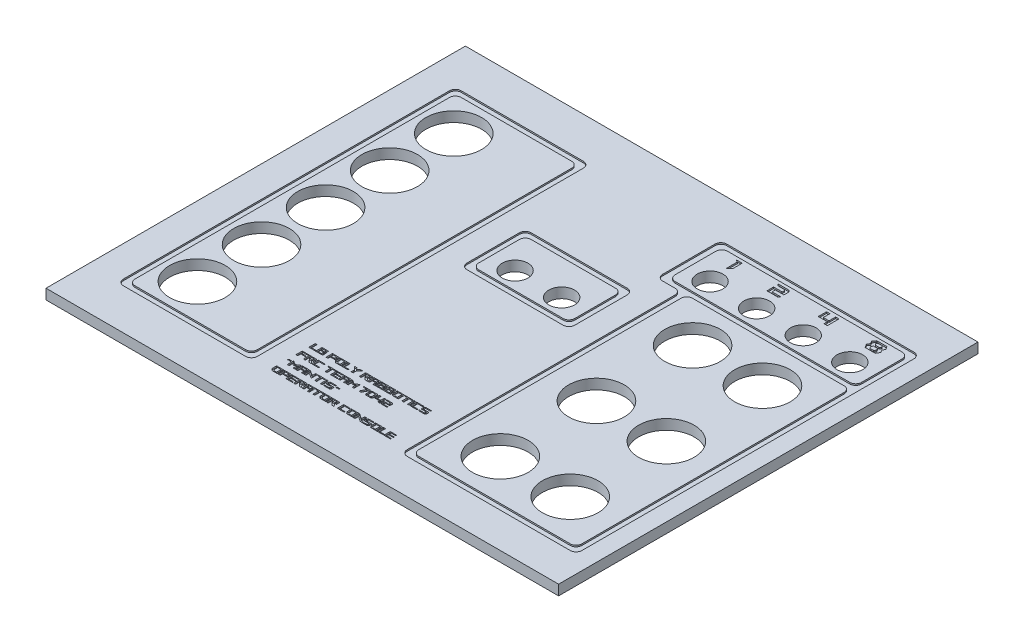
from build123d import *

# Parameters (mm, degrees)
SKETCH1_W           = 279.4
SKETCH1_H           = 228.6
BOSS_EXTRUDE1_DEPTH = 5.55625
SKETCH2_R           = 15.160625
CUT_EXTRUDE1_DEPTH  = 181.586411211
SKETCH3_R           = 7.0246875
SKETCH3_R_2         = 15.160625
CUT_EXTRUDE2_DEPTH  = 181.586411211
SKETCH4_W           = 73.025
SKETCH4_H           = 184.15
SKETCH4_W_2         = 66.675
SKETCH4_H_2         = 177.8
SKETCH4_W_3         = 88.9
SKETCH4_H_3         = 149.225
SKETCH4_W_4         = 101.6
SKETCH4_H_4         = 28.575
CUT_EXTRUDE3_DEPTH  = 0.79375
FILLET1_R           = 3.175
SKETCH5_W           = 1.743010591
SKETCH5_H           = 0.819065149
SKETCH5_H_2         = 1.141619432
SKETCH5_W_2         = 1.782964988
SKETCH5_H_3         = 1.234104295
SKETCH5_W_3         = 1.807936488
SKETCH5_H_4         = 0.965318114
SKETCH5_W_4         = 1.743010592
SKETCH5_W_5         = 1.049133865
SKETCH5_H_5         = 3.5
SKETCH5_W_6         = 1.807936487
SKETCH5_W_7         = 1.782964989
CUT_EXTRUDE4_DEPTH  = 0.79375
CUT_EXTRUDE5_DEPTH  = 0.79375
CUT_EXTRUDE6_DEPTH  = 0.79375
SKETCH8_R           = 7.0246875
CUT_EXTRUDE7_DEPTH  = 181.586411211


with BuildPart() as part:
    # Sketch1 → Boss-Extrude1 (new body)
    with BuildSketch(Plane(origin=(0, 0, 0), x_dir=(1, 0, 0), z_dir=(0, 1, 0))):
        Rectangle(SKETCH1_W, SKETCH1_H)
    extrude(amount=BOSS_EXTRUDE1_DEPTH)

    # Sketch2 → Cut-Extrude1 (cut, through all)
    with BuildSketch(Plane(origin=(0, 5.55625, 0), x_dir=(1, 0, 0), z_dir=(0, 1, 0))):
        with Locations((-101.6, 69.85)):
            Circle(SKETCH2_R)
        with Locations((-101.6, 34.925)):
            Circle(SKETCH2_R)
        with Locations((-101.6, 0)):
            Circle(SKETCH2_R)
        with Locations((-101.6, -34.925)):
            Circle(SKETCH2_R)
        with Locations((-101.6, -69.85)):
            Circle(SKETCH2_R)
    extrude(amount=-CUT_EXTRUDE1_DEPTH, mode=Mode.SUBTRACT)

    # Sketch3 → Cut-Extrude2 (cut, through all)
    with BuildSketch(Plane(origin=(0, 5.55625, 0), x_dir=(1, 0, 0), z_dir=(0, 1, 0))):
        with Locations((38.1, 69.85)):
            Circle(SKETCH3_R)
        with Locations((63.5, 69.85)):
            Circle(SKETCH3_R)
        with Locations((88.9, 69.85)):
            Circle(SKETCH3_R)
        with Locations((114.3, 69.85)):
            Circle(SKETCH3_R)
        with Locations((63.5, 34.925)):
            Circle(SKETCH3_R_2)
        with Locations((101.6, 34.925)):
            Circle(SKETCH3_R_2)
        with Locations((101.6, -17.4625)):
            Circle(SKETCH3_R_2)
        with Locations((63.5, -17.4625)):
            Circle(SKETCH3_R_2)
        with Locations((101.6, -69.85)):
            Circle(SKETCH3_R_2)
        with Locations((63.5, -69.85)):
            Circle(SKETCH3_R_2)
    extrude(amount=-CUT_EXTRUDE2_DEPTH, mode=Mode.SUBTRACT)

    # Sketch4 → Cut-Extrude3 (cut)
    # profile 1 of 2: a face of its own
    with BuildSketch(Plane(origin=(0, 5.55625, 0), x_dir=(1, 0, 0), z_dir=(0, 1, 0))):
        with Locations((-86.439375, 0)):
            Rectangle(SKETCH4_W, SKETCH4_H)
        with Locations((-86.439375, 0)):
            Rectangle(SKETCH4_W_2, SKETCH4_H_2, mode=Mode.SUBTRACT)
    # profile 2 of 2: a face of its own
    with BuildSketch(Plane(origin=(0, 5.55625, 0), x_dir=(1, 0, 0), z_dir=(0, 1, 0))):
        Polygon((130.175, 60.325), (130.175, -95.25), (34.925, -95.25), (34.925, 57.15), (21.779463134, 57.15), (21.779463134, 92.075), (130.175, 92.075), align=None)
        with Locations((82.55, -17.4625)):
            Rectangle(SKETCH4_W_3, SKETCH4_H_3, mode=Mode.SUBTRACT)
        with Locations((76.2, 74.6125)):
            Rectangle(SKETCH4_W_4, SKETCH4_H_4, mode=Mode.SUBTRACT)
    extrude(amount=-CUT_EXTRUDE3_DEPTH, mode=Mode.SUBTRACT)

    # Fillet1
    fillet1_edges = [part.edges().sort_by_distance(p)[0] for p in [
        (130.175, 5.159375, 95.25),
        (127, 5.159375, 92.075),
        (34.925, 5.159375, 95.25),
        (38.1, 5.159375, 92.075),
        (-119.776875, 5.159375, 88.9),
        (-122.951875, 5.159375, 92.075),
        (-49.926875, 5.159375, 92.075),
        (-53.101875, 5.159375, 88.9),
        (38.1, 5.159375, -57.15),
        (127, 5.159375, -57.15),
        (34.925, 5.159375, -57.15),
        (127, 5.159375, -60.325),
        (130.175, 5.159375, -92.075),
        (127, 5.159375, -88.9),
        (21.779463134, 5.159375, -57.15),
        (25.4, 5.159375, -60.325),
        (21.779463134, 5.159375, -92.075),
        (25.4, 5.159375, -88.9),
        (-49.926875, 5.159375, -92.075),
        (-53.101875, 5.159375, -88.9),
        (-122.951875, 5.159375, -92.075),
        (-119.776875, 5.159375, -88.9),
    ]]
    fillet(fillet1_edges, radius=FILLET1_R)

    # Sketch5 → Cut-Extrude4 (cut)
    # profile 1 of 51: a face of its own
    with BuildSketch(Plane(origin=(0, 5.55625, 0), x_dir=(1, 0, 0), z_dir=(0, 1, 0))):
        Polygon((-36.802163997, -70.03379494), (-37.252626826, -70.54878923), (-40.209679135, -70.54878923), (-40.209679135, -67.04878923), (-39.163953361, -67.04878923), (-39.163953361, -70.03379494), align=None)
    # profile 2 of 51: a face of its own
    with BuildSketch(Plane(origin=(0, 5.55625, 0), x_dir=(1, 0, 0), z_dir=(0, 1, 0))):
        Polygon((-32.683092397, -70.55453218), (-36.513720258, -70.55453218), (-36.513720258, -67.04247403), (-32.987744678, -67.04247403), (-32.987744678, -68.375952047), (-32.683092397, -68.375952047), align=None)
        with Locations((-34.598406328, -67.966419473)):
            Rectangle(SKETCH5_W, SKETCH5_H, mode=Mode.SUBTRACT)
        with Locations((-34.598406328, -69.469309596)):
            Rectangle(SKETCH5_W, SKETCH5_H_2, mode=Mode.SUBTRACT)
    # profile 3 of 51: a face of its own
    with BuildSketch(Plane(origin=(0, 5.55625, 0), x_dir=(1, 0, 0), z_dir=(0, 1, 0))):
        Polygon((-29.773910712, -69.305977015), (-29.773910712, -70.544563338), (-30.822713646, -70.544563338), (-30.822713646, -67.043046984), (-26.952131388, -67.043046984), (-26.952131388, -69.305977015), align=None)
        with Locations((-28.892416817, -68.174511999)):
            Rectangle(SKETCH5_W_2, SKETCH5_H_3, mode=Mode.SUBTRACT)
    # profile 4 of 51: a face of its own
    with BuildSketch(Plane(origin=(0, 5.55625, 0), x_dir=(1, 0, 0), z_dir=(0, 1, 0))):
        Polygon((-22.605629343, -70.553124491), (-22.605629343, -67.044453969), (-26.568057888, -67.044453969), (-26.568057888, -69.594269754), (-25.714708614, -70.553124491), align=None)
        Polygon((-23.654763208, -67.547344949), (-23.654763208, -70.050234216), (-24.928968668, -70.050234216), (-25.518924023, -69.366287524), (-25.518924023, -67.547344949), align=None, mode=Mode.SUBTRACT)
    # profile 5 of 51: a face of its own
    with BuildSketch(Plane(origin=(0, 5.55625, 0), x_dir=(1, 0, 0), z_dir=(0, 1, 0))):
        Polygon((-18.813721064, -70.03379494), (-19.264183893, -70.54878923), (-22.221236202, -70.54878923), (-22.221236202, -67.04878923), (-21.175510428, -67.04878923), (-21.175510428, -70.03379494), align=None)
    # profile 6 of 51: a face of its own
    with BuildSketch(Plane(origin=(0, 5.55625, 0), x_dir=(1, 0, 0), z_dir=(0, 1, 0))):
        Polygon((-17.088287191, -70.553125196), (-16.039154031, -70.553125196), (-16.039154031, -68.905006299), (-14.401023733, -67.057115414), (-15.609644258, -67.057115414), (-16.563737545, -68.135884147), (-17.517796964, -67.057115414), (-18.726417488, -67.057115414), (-17.088287191, -68.905006299), align=None)
    # profile 7 of 51: a face of its own
    with BuildSketch(Plane(origin=(0, 5.55625, 0), x_dir=(1, 0, 0), z_dir=(0, 1, 0))):
        Polygon((-8.386582238, -70.573506709), (-9.620174261, -70.573506709), (-11.503025243, -68.425957843), (-9.735043154, -68.425957843), (-9.735043154, -67.599367375), (-11.635973953, -67.599367375), (-11.635973953, -70.573506709), (-12.694765486, -70.573506709), (-12.694765486, -67.084954507), (-8.706217418, -67.084954507), (-8.706217418, -68.940370711), (-9.814951949, -68.940370711), align=None)
    # profile 8 of 51: a face of its own
    with BuildSketch(Plane(origin=(0, 5.55625, 0), x_dir=(1, 0, 0), z_dir=(0, 1, 0))):
        Polygon((-4.199478651, -67.084954507), (-4.199478651, -70.572393964), (-5.248281586, -70.572393964), (-5.248281586, -69.084092657), (-7.096172471, -69.084092657), (-7.096172471, -70.572393964), (-8.164952604, -70.572393964), (-8.164952604, -67.084954507), align=None)
        with Locations((-6.177221328, -68.082026432)):
            Rectangle(SKETCH5_W_3, SKETCH5_H_4, mode=Mode.SUBTRACT)
    # profile 9 of 51: a face of its own
    with BuildSketch(Plane(origin=(0, 5.55625, 0), x_dir=(1, 0, 0), z_dir=(0, 1, 0))):
        Polygon((0.010555813, -70.55453218), (-3.820072048, -70.55453218), (-3.820072048, -67.04247403), (-0.294096468, -67.04247403), (-0.294096468, -68.375952047), (0.010555813, -68.375952047), align=None)
        with Locations((-1.904758118, -67.966419473)):
            Rectangle(SKETCH5_W, SKETCH5_H, mode=Mode.SUBTRACT)
        with Locations((-1.904758118, -69.469309596)):
            Rectangle(SKETCH5_W, SKETCH5_H_2, mode=Mode.SUBTRACT)
    # profile 10 of 51: a face of its own
    with BuildSketch(Plane(origin=(0, 5.55625, 0), x_dir=(1, 0, 0), z_dir=(0, 1, 0))):
        Polygon((4.218649146, -70.55453218), (0.388021286, -70.55453218), (0.388021286, -67.04247403), (3.913996865, -67.04247403), (3.913996865, -68.375952047), (4.218649146, -68.375952047), align=None)
        with Locations((2.303335216, -67.966419473)):
            Rectangle(SKETCH5_W_4, SKETCH5_H, mode=Mode.SUBTRACT)
        with Locations((2.303335216, -69.469309596)):
            Rectangle(SKETCH5_W_4, SKETCH5_H_2, mode=Mode.SUBTRACT)
    # profile 11 of 51: a face of its own
    with BuildSketch(Plane(origin=(0, 5.55625, 0), x_dir=(1, 0, 0), z_dir=(0, 1, 0))):
        Polygon((8.562006998, -70.553124491), (8.562006998, -67.044453969), (4.599578454, -67.044453969), (4.599578454, -69.594269754), (5.452927727, -70.553124491), align=None)
        Polygon((7.512873133, -67.547344949), (7.512873133, -70.050234216), (6.238667674, -70.050234216), (5.648712319, -69.366287524), (5.648712319, -67.547344949), align=None, mode=Mode.SUBTRACT)
    # profile 12 of 51: a face of its own
    with BuildSketch(Plane(origin=(0, 5.55625, 0), x_dir=(1, 0, 0), z_dir=(0, 1, 0))):
        Polygon((12.839335381, -67.563822328), (11.5483703, -67.563822328), (11.5483703, -70.54878923), (10.506626277, -70.54878923), (10.506626277, -67.563822328), (9.200707932, -67.563822328), (8.757094448, -67.04878923), (13.28310551, -67.04878923), align=None)
    # profile 13 of 51: a face of its own
    with BuildSketch(Plane(origin=(0, 5.55625, 0), x_dir=(1, 0, 0), z_dir=(0, 1, 0))):
        with Locations((14.09524546, -68.79878923)):
            Rectangle(SKETCH5_W_5, SKETCH5_H_5)
    # profile 14 of 51: a face of its own
    with BuildSketch(Plane(origin=(0, 5.55625, 0), x_dir=(1, 0, 0), z_dir=(0, 1, 0))):
        Polygon((19.063454202, -70.03379494), (18.615261317, -70.54878923), (15.138597919, -70.54878923), (15.138597919, -67.04878923), (19.058560804, -67.04878923), (18.615261317, -67.563822328), (16.204509047, -67.563822328), (16.204509047, -70.03379494), align=None)
    # profile 15 of 51: a face of its own
    with BuildSketch(Plane(origin=(0, 5.55625, 0), x_dir=(1, 0, 0), z_dir=(0, 1, 0))):
        Polygon((23.383155104, -70.029679123), (22.930792776, -70.558867441), (19.794082567, -70.558867441), (19.346691253, -70.044454573), (22.14537247, -70.044454573), (22.32930001, -69.832673123), (22.32930001, -69.079135754), (19.480908647, -69.079135754), (19.480908647, -67.638932277), (19.953155034, -67.084954507), (23.50276075, -67.084954507), (23.06501017, -67.599367375), (20.743546354, -67.599367375), (20.519850698, -67.85180601), (20.519850698, -68.564685489), (23.383155104, -68.564685489), align=None)
    # profile 16 of 51: a face of its own
    with BuildSketch(Plane(origin=(0, 5.55625, 0), x_dir=(1, 0, 0), z_dir=(0, 1, 0))):
        Polygon((-39.190410166, -75.905689832), (-39.190410166, -77.568791629), (-40.209679135, -77.568791629), (-40.209679135, -74.096516413), (-36.432222432, -74.096516413), (-36.872072903, -74.610929281), (-39.190410166, -74.610929281), (-39.190410166, -75.391276965), (-36.577284329, -75.391276965), (-37.026961815, -75.905689832), align=None)
    # profile 17 of 51: a face of its own
    with BuildSketch(Plane(origin=(0, 5.55625, 0), x_dir=(1, 0, 0), z_dir=(0, 1, 0))):
        Polygon((-31.83167367, -77.585068614), (-33.065265693, -77.585068614), (-34.948116675, -75.437519748), (-33.180134585, -75.437519748), (-33.180134585, -74.610929281), (-35.081065384, -74.610929281), (-35.081065384, -77.585068614), (-36.139856918, -77.585068614), (-36.139856918, -74.096516413), (-32.15130885, -74.096516413), (-32.15130885, -75.951932616), (-33.26004338, -75.951932616), align=None)
    # profile 18 of 51: a face of its own
    with BuildSketch(Plane(origin=(0, 5.55625, 0), x_dir=(1, 0, 0), z_dir=(0, 1, 0))):
        Polygon((-27.68800031, -77.045356846), (-28.136193195, -77.560351135), (-31.612856593, -77.560351135), (-31.612856593, -74.060351135), (-27.692893708, -74.060351135), (-28.136193195, -74.575384233), (-30.546945465, -74.575384233), (-30.546945465, -77.045356846), align=None)
    # profile 19 of 51: a face of its own
    with BuildSketch(Plane(origin=(0, 5.55625, 0), x_dir=(1, 0, 0), z_dir=(0, 1, 0))):
        Polygon((-21.981480887, -74.575384233), (-23.272445969, -74.575384233), (-23.272445969, -77.560351135), (-24.314189992, -77.560351135), (-24.314189992, -74.575384233), (-25.620108337, -74.575384233), (-26.06372182, -74.060351135), (-21.537710758, -74.060351135), align=None)
    # profile 20 of 51: a face of its own
    with BuildSketch(Plane(origin=(0, 5.55625, 0), x_dir=(1, 0, 0), z_dir=(0, 1, 0))):
        Polygon((-17.881404278, -77.056016479), (-17.431980811, -77.570429347), (-21.346958569, -77.570429347), (-21.346958569, -74.096516413), (-17.422102287, -74.096516413), (-17.866423496, -74.610929281), (-20.298303813, -74.610929281), (-20.298303813, -75.576247395), (-17.656692545, -75.576247395), (-17.656692545, -76.09069766), (-20.298303813, -76.09069766), (-20.298303813, -77.056016479), align=None)
    # profile 21 of 51: a face of its own
    with BuildSketch(Plane(origin=(0, 5.55625, 0), x_dir=(1, 0, 0), z_dir=(0, 1, 0))):
        Polygon((-13.170578726, -74.096516413), (-13.170578726, -77.583955869), (-14.21938166, -77.583955869), (-14.21938166, -76.095654562), (-16.067272545, -76.095654562), (-16.067272545, -77.583955869), (-17.136052678, -77.583955869), (-17.136052678, -74.096516413), align=None)
        with Locations((-15.148321403, -75.093588338)):
            Rectangle(SKETCH5_W_6, SKETCH5_H_4, mode=Mode.SUBTRACT)
    # profile 22 of 51: a face of its own
    with BuildSketch(Plane(origin=(0, 5.55625, 0), x_dir=(1, 0, 0), z_dir=(0, 1, 0))):
        Polygon((-12.79204355, -77.560351135), (-12.79204355, -74.060351135), (-10.64467038, -75.46037442), (-8.497245702, -74.060351135), (-8.497245702, -77.560351135), (-9.528634209, -77.560351135), (-9.528634209, -75.555373367), (-10.64467038, -76.265365494), (-11.750741943, -75.555373367), (-11.750741943, -77.560351135), align=None)
    # profile 23 of 51: a face of its own
    with BuildSketch(Plane(origin=(0, 5.55625, 0), x_dir=(1, 0, 0), z_dir=(0, 1, 0))):
        Polygon((-5.907196803, -77.564687102), (-4.701469275, -77.564687102), (-2.855625362, -74.056015874), (-6.780480939, -74.056015874), (-6.338877029, -74.558906855), (-4.438491666, -74.558906855), align=None)
    # profile 24 of 51: a face of its own
    with BuildSketch(Plane(origin=(0, 5.55625, 0), x_dir=(1, 0, 0), z_dir=(0, 1, 0))):
        Polygon((1.259981699, -74.609532881), (0.796130647, -74.056015874), (-2.196113199, -74.056015874), (-2.664873878, -74.609532881), (-2.664873878, -77.01133803), (-2.196113199, -77.564686396), (0.796130647, -77.564686396), (1.259981699, -77.01133803), align=None)
        Polygon((0.248420801, -74.851731719), (0.248420801, -76.759047573), (-0.004468012, -77.061796121), (-1.395364246, -77.061796121), (-1.653312275, -76.759047573), (-1.653312275, -74.851731719), (-1.395364246, -74.558906855), (-0.004468012, -74.558906855), align=None, mode=Mode.SUBTRACT)
    # profile 25 of 51: a face of its own
    with BuildSketch(Plane(origin=(0, 5.55625, 0), x_dir=(1, 0, 0), z_dir=(0, 1, 0))):
        Polygon((4.410271351, -77.564687102), (5.421832955, -77.564687102), (5.421832955, -74.066712199), (4.410271351, -74.066712199), (4.410271351, -76.044454876), (2.693509411, -76.044454876), (2.693509411, -74.066712199), (1.681947807, -74.066712199), (1.681947807, -76.547345856), (4.410271351, -76.547345856), align=None)
    # profile 26 of 51: a face of its own
    with BuildSketch(Plane(origin=(0, 5.55625, 0), x_dir=(1, 0, 0), z_dir=(0, 1, 0))):
        Polygon((9.180457662, -77.570429347), (5.871108244, -77.570429347), (5.871108244, -75.576247395), (8.451701983, -75.576247395), (8.451701983, -74.863367916), (8.227085507, -74.610929281), (6.190562788, -74.610929281), (5.75131279, -74.096516413), (9.02073039, -74.096516413), (9.494920729, -74.650494182), (9.494920729, -76.09069766), (6.929301421, -76.09069766), (6.929301421, -77.056016479), (9.629925583, -77.056016479), align=None)
    # profile 27 of 51: a face of its own
    with BuildSketch(Plane(origin=(0, 5.55625, 0), x_dir=(1, 0, 0), z_dir=(0, 1, 0))):
        Polygon((-40.259648945, -82.213532474), (-39.600401386, -82.213532474), (-39.245806108, -81.626826447), (-39.895065068, -81.626826447), align=None)
    # profile 28 of 51: a face of its own
    with BuildSketch(Plane(origin=(0, 5.55625, 0), x_dir=(1, 0, 0), z_dir=(0, 1, 0))):
        Polygon((-39.245806108, -82.213532474), (-38.58655855, -82.213532474), (-38.231963272, -81.626826447), (-38.881222231, -81.626826447), align=None)
    # profile 29 of 51: a face of its own
    with BuildSketch(Plane(origin=(0, 5.55625, 0), x_dir=(1, 0, 0), z_dir=(0, 1, 0))):
        Polygon((-37.901875202, -84.571913041), (-37.901875202, -81.071913041), (-35.754502032, -82.471936326), (-33.607077354, -81.071913041), (-33.607077354, -84.571913041), (-34.638465861, -84.571913041), (-34.638465861, -82.566935272), (-35.754502032, -83.2769274), (-36.860573595, -82.566935272), (-36.860573595, -84.571913041), align=None)
    # profile 30 of 51: a face of its own
    with BuildSketch(Plane(origin=(0, 5.55625, 0), x_dir=(1, 0, 0), z_dir=(0, 1, 0))):
        Polygon((-29.216824735, -81.108078319), (-29.216824735, -84.595517775), (-30.26562767, -84.595517775), (-30.26562767, -83.107216468), (-32.113518555, -83.107216468), (-32.113518555, -84.595517775), (-33.182298688, -84.595517775), (-33.182298688, -81.108078319), align=None)
        with Locations((-31.194567412, -82.105150243)):
            Rectangle(SKETCH5_W_3, SKETCH5_H_4, mode=Mode.SUBTRACT)
    # profile 31 of 51: a face of its own
    with BuildSketch(Plane(origin=(0, 5.55625, 0), x_dir=(1, 0, 0), z_dir=(0, 1, 0))):
        Polygon((-24.913433982, -84.571913041), (-27.755464281, -82.666934164), (-27.755464281, -84.571913041), (-28.792046775, -84.571913041), (-28.792046775, -81.071913041), (-25.93524526, -82.961930893), (-25.93524526, -81.071913041), (-24.913433982, -81.071913041), align=None)
    # profile 32 of 51: a face of its own
    with BuildSketch(Plane(origin=(0, 5.55625, 0), x_dir=(1, 0, 0), z_dir=(0, 1, 0))):
        Polygon((-20.640440154, -81.586946139), (-21.931405236, -81.586946139), (-21.931405236, -84.571913041), (-22.973149259, -84.571913041), (-22.973149259, -81.586946139), (-24.279067604, -81.586946139), (-24.722681088, -81.071913041), (-20.196670026, -81.071913041), align=None)
    # profile 33 of 51: a face of its own
    with BuildSketch(Plane(origin=(0, 5.55625, 0), x_dir=(1, 0, 0), z_dir=(0, 1, 0))):
        with Locations((-19.384530076, -82.821913041)):
            Rectangle(SKETCH5_W_5, SKETCH5_H_5)
    # profile 34 of 51: a face of its own
    with BuildSketch(Plane(origin=(0, 5.55625, 0), x_dir=(1, 0, 0), z_dir=(0, 1, 0))):
        Polygon((-14.350956549, -84.052802935), (-14.803318877, -84.581991252), (-17.940029087, -84.581991252), (-18.3874204, -84.067578385), (-15.588739183, -84.067578385), (-15.404811643, -83.855796934), (-15.404811643, -83.102259565), (-18.253203006, -83.102259565), (-18.253203006, -81.662056088), (-17.78095662, -81.108078319), (-14.231350904, -81.108078319), (-14.669101483, -81.622491186), (-16.990565299, -81.622491186), (-17.214260956, -81.874929821), (-17.214260956, -82.5878093), (-14.350956549, -82.5878093), align=None)
    # profile 35 of 51: a face of its own
    with BuildSketch(Plane(origin=(0, 5.55625, 0), x_dir=(1, 0, 0), z_dir=(0, 1, 0))):
        Polygon((-13.947504912, -82.213532474), (-13.288257353, -82.213532474), (-12.933662075, -81.626826447), (-13.582921035, -81.626826447), align=None)
    # profile 36 of 51: a face of its own
    with BuildSketch(Plane(origin=(0, 5.55625, 0), x_dir=(1, 0, 0), z_dir=(0, 1, 0))):
        Polygon((-12.933662075, -82.213532474), (-12.274414517, -82.213532474), (-11.919819239, -81.626826447), (-12.569078198, -81.626826447), align=None)
    # profile 37 of 51: a face of its own
    with BuildSketch(Plane(origin=(0, 5.55625, 0), x_dir=(1, 0, 0), z_dir=(0, 1, 0))):
        Polygon((-36.247250591, -91.587810207), (-36.247250591, -88.079139685), (-40.209679135, -88.079139685), (-40.209679135, -90.628955471), (-39.356329862, -91.587810207), align=None)
        Polygon((-37.296384456, -88.582030666), (-37.296384456, -91.084919933), (-38.570589915, -91.084919933), (-39.16054527, -90.40097324), (-39.16054527, -88.582030666), align=None, mode=Mode.SUBTRACT)
    # profile 38 of 51: a face of its own
    with BuildSketch(Plane(origin=(0, 5.55625, 0), x_dir=(1, 0, 0), z_dir=(0, 1, 0))):
        Polygon((-34.814374156, -90.340662732), (-34.814374156, -91.579249055), (-35.86317709, -91.579249055), (-35.86317709, -88.077732701), (-31.992594832, -88.077732701), (-31.992594832, -90.340662732), align=None)
        with Locations((-33.93288026, -89.209197717)):
            Rectangle(SKETCH5_W_7, SKETCH5_H_3, mode=Mode.SUBTRACT)
    # profile 39 of 51: a face of its own
    with BuildSketch(Plane(origin=(0, 5.55625, 0), x_dir=(1, 0, 0), z_dir=(0, 1, 0))):
        Polygon((-28.147302302, -91.07914029), (-27.697878834, -91.593553158), (-31.612856593, -91.593553158), (-31.612856593, -88.119640224), (-27.68800031, -88.119640224), (-28.132321519, -88.634053092), (-30.564201836, -88.634053092), (-30.564201836, -89.599371206), (-27.922590568, -89.599371206), (-27.922590568, -90.113821471), (-30.564201836, -90.113821471), (-30.564201836, -91.07914029), align=None)
    # profile 40 of 51: a face of its own
    with BuildSketch(Plane(origin=(0, 5.55625, 0), x_dir=(1, 0, 0), z_dir=(0, 1, 0))):
        Polygon((-23.091787515, -91.608192426), (-24.325379538, -91.608192426), (-26.20823052, -89.46064356), (-24.44024843, -89.46064356), (-24.44024843, -88.634053092), (-26.341179229, -88.634053092), (-26.341179229, -91.608192426), (-27.399970763, -91.608192426), (-27.399970763, -88.119640224), (-23.411422695, -88.119640224), (-23.411422695, -89.975056428), (-24.520157225, -89.975056428), align=None)
    # profile 41 of 51: a face of its own
    with BuildSketch(Plane(origin=(0, 5.55625, 0), x_dir=(1, 0, 0), z_dir=(0, 1, 0))):
        Polygon((-18.904683928, -88.119640224), (-18.904683928, -91.60707968), (-19.953486863, -91.60707968), (-19.953486863, -90.118778373), (-21.801377747, -90.118778373), (-21.801377747, -91.60707968), (-22.870157881, -91.60707968), (-22.870157881, -88.119640224), align=None)
        with Locations((-20.882426605, -89.116712149)):
            Rectangle(SKETCH5_W_6, SKETCH5_H_4, mode=Mode.SUBTRACT)
    # profile 42 of 51: a face of its own
    with BuildSketch(Plane(origin=(0, 5.55625, 0), x_dir=(1, 0, 0), z_dir=(0, 1, 0))):
        Polygon((-14.628878249, -88.598508044), (-15.91984333, -88.598508044), (-15.91984333, -91.583474946), (-16.961587353, -91.583474946), (-16.961587353, -88.598508044), (-18.267505698, -88.598508044), (-18.711119182, -88.083474946), (-14.18510812, -88.083474946), align=None)
    # profile 43 of 51: a face of its own
    with BuildSketch(Plane(origin=(0, 5.55625, 0), x_dir=(1, 0, 0), z_dir=(0, 1, 0))):
        Polygon((-10.027592125, -91.587810207), (-10.027592125, -88.079139685), (-13.99002067, -88.079139685), (-13.99002067, -90.628955471), (-13.136671397, -91.587810207), align=None)
        Polygon((-11.076725991, -88.582030666), (-11.076725991, -91.084919933), (-12.35093145, -91.084919933), (-12.940886805, -90.40097324), (-12.940886805, -88.582030666), align=None, mode=Mode.SUBTRACT)
    # profile 44 of 51: a face of its own
    with BuildSketch(Plane(origin=(0, 5.55625, 0), x_dir=(1, 0, 0), z_dir=(0, 1, 0))):
        Polygon((-5.334558501, -91.608192426), (-6.568150524, -91.608192426), (-8.451001507, -89.46064356), (-6.683019417, -89.46064356), (-6.683019417, -88.634053092), (-8.583950216, -88.634053092), (-8.583950216, -91.608192426), (-9.64274175, -91.608192426), (-9.64274175, -88.119640224), (-5.654193681, -88.119640224), (-5.654193681, -89.975056428), (-6.762928212, -89.975056428), align=None)
    # profile 45 of 51: a face of its own
    with BuildSketch(Plane(origin=(0, 5.55625, 0), x_dir=(1, 0, 0), z_dir=(0, 1, 0))):
        Polygon((0.288883943, -91.068480657), (-0.159308942, -91.583474946), (-3.63597234, -91.583474946), (-3.63597234, -88.083474946), (0.283990545, -88.083474946), (-0.159308942, -88.598508044), (-2.570061212, -88.598508044), (-2.570061212, -91.068480657), align=None)
    # profile 46 of 51: a face of its own
    with BuildSketch(Plane(origin=(0, 5.55625, 0), x_dir=(1, 0, 0), z_dir=(0, 1, 0))):
        Polygon((4.585127584, -91.587810207), (4.585127584, -88.079139685), (0.622699039, -88.079139685), (0.622699039, -90.628955471), (1.476048312, -91.587810207), align=None)
        Polygon((3.535993718, -88.582030666), (3.535993718, -91.084919933), (2.261788259, -91.084919933), (1.671832904, -90.40097324), (1.671832904, -88.582030666), align=None, mode=Mode.SUBTRACT)
    # profile 47 of 51: a face of its own
    with BuildSketch(Plane(origin=(0, 5.55625, 0), x_dir=(1, 0, 0), z_dir=(0, 1, 0))):
        Polygon((8.890041041, -91.583474946), (6.048010742, -89.678496069), (6.048010742, -91.583474946), (5.011428248, -91.583474946), (5.011428248, -88.083474946), (7.868229763, -89.973492798), (7.868229763, -88.083474946), (8.890041041, -88.083474946), align=None)
    # profile 48 of 51: a face of its own
    with BuildSketch(Plane(origin=(0, 5.55625, 0), x_dir=(1, 0, 0), z_dir=(0, 1, 0))):
        Polygon((13.255985433, -91.06436484), (12.803623104, -91.593553158), (9.666912895, -91.593553158), (9.219521581, -91.07914029), (12.018202798, -91.07914029), (12.202130338, -90.867358839), (12.202130338, -90.113821471), (9.353738975, -90.113821471), (9.353738975, -88.673617993), (9.825985362, -88.119640224), (13.375591078, -88.119640224), (12.937840498, -88.634053092), (10.616376683, -88.634053092), (10.392681026, -88.886491727), (10.392681026, -89.599371206), (13.255985433, -89.599371206), align=None)
    # profile 49 of 51: a face of its own
    with BuildSketch(Plane(origin=(0, 5.55625, 0), x_dir=(1, 0, 0), z_dir=(0, 1, 0))):
        Polygon((17.671835424, -91.587810207), (17.671835424, -88.079139685), (13.70940688, -88.079139685), (13.70940688, -90.628955471), (14.562756153, -91.587810207), align=None)
        Polygon((16.622701559, -88.582030666), (16.622701559, -91.084919933), (15.3484961, -91.084919933), (14.758540745, -90.40097324), (14.758540745, -88.582030666), align=None, mode=Mode.SUBTRACT)
    # profile 50 of 51: a face of its own
    with BuildSketch(Plane(origin=(0, 5.55625, 0), x_dir=(1, 0, 0), z_dir=(0, 1, 0))):
        Polygon((21.463743703, -91.068480657), (21.013280874, -91.583474946), (18.056228565, -91.583474946), (18.056228565, -88.083474946), (19.101954339, -88.083474946), (19.101954339, -91.068480657), align=None)
    # profile 51 of 51: a face of its own
    with BuildSketch(Plane(origin=(0, 5.55625, 0), x_dir=(1, 0, 0), z_dir=(0, 1, 0))):
        Polygon((25.216870306, -91.07914029), (25.666293774, -91.593553158), (21.751316015, -91.593553158), (21.751316015, -88.119640224), (25.676172298, -88.119640224), (25.231851089, -88.634053092), (22.799970772, -88.634053092), (22.799970772, -89.599371206), (25.44158204, -89.599371206), (25.44158204, -90.113821471), (22.799970772, -90.113821471), (22.799970772, -91.07914029), align=None)
    extrude(amount=-CUT_EXTRUDE4_DEPTH, mode=Mode.SUBTRACT)

    # Sketch6 → Cut-Extrude5 (cut)
    # profile 1 of 4: a face of its own
    with BuildSketch(Plane(origin=(0, 5.55625, 0), x_dir=(1, 0, 0), z_dir=(0, 1, 0))):
        Polygon((36.349512189, 86.430530343), (34.879649813, 87.249576783), (38.225068778, 87.249576783), (38.225068778, 82.021334949), (36.349512189, 80.212665002), align=None)
    # profile 2 of 4: a face of its own
    with BuildSketch(Plane(origin=(0, 5.55625, 0), x_dir=(1, 0, 0), z_dir=(0, 1, 0))):
        Polygon((64.005149228, 80.957324248), (58.001043854, 80.957324248), (58.001043854, 84.575340076), (62.682978211, 84.575340076), (62.682978211, 85.86870713), (62.275459746, 86.326702939), (58.58062567, 86.326702939), (57.783700673, 87.259994857), (63.71535832, 87.259994857), (64.575675078, 86.254920904), (64.575675078, 83.641980309), (59.920908619, 83.641980309), (59.920908619, 81.890616165), (64.820612455, 81.890616165), align=None)
    # profile 3 of 4: a face of its own
    with BuildSketch(Plane(origin=(0, 5.55625, 0), x_dir=(1, 0, 0), z_dir=(0, 1, 0))):
        Polygon((89.077512473, 80.967742321), (90.912774239, 80.967742321), (90.912774239, 87.314068216), (89.077512473, 87.314068216), (89.077512473, 83.725877931), (85.96281581, 83.725877931), (85.96281581, 87.314068216), (84.127554044, 87.314068216), (84.127554044, 82.81349001), (89.077512473, 82.81349001), align=None)
    # profile 4 of 4: a face of its own
    with BuildSketch(Plane(origin=(0, 5.55625, 0), x_dir=(1, 0, 0), z_dir=(0, 1, 0))):
        Polygon((118.179500174, 82.933671664), (117.229695264, 84.39132372), (118.179500174, 85.609481708), (116.994606282, 87.333474406), (111.488098965, 87.333474406), (110.30361217, 85.609481708), (111.253009983, 84.39132372), (110.30361217, 82.933671664), (111.488098965, 80.967743601), (116.994606282, 80.967743601), align=None)
        Polygon((112.564083154, 85.609481708), (113.187973145, 86.421086484), (115.294732102, 86.421086484), (115.918622094, 85.609481708), (115.294732102, 84.81654702), (113.187973145, 84.81654702), align=None, mode=Mode.SUBTRACT)
        Polygon((115.918622094, 82.933671664), (115.285690218, 81.880130243), (113.197015029, 81.880130243), (112.564083154, 82.952154846), (113.169889377, 83.904159098), (115.31281587, 83.904159098), align=None, mode=Mode.SUBTRACT)
    extrude(amount=-CUT_EXTRUDE5_DEPTH, mode=Mode.SUBTRACT)

    # Sketch7 → Cut-Extrude6 (cut)
    with BuildSketch(Plane(origin=(0, 5.55625, 0), x_dir=(1, 0, 0), z_dir=(0, 1, 0))):
        with BuildLine():
            Line((-33.6946875, 44.0928125), (18.6928125, 44.0928125))
            ThreePointArc((18.6928125, 44.0928125), (20.93787653, 43.16287653), (21.8678125, 40.9178125))
            Line((21.8678125, 40.9178125), (21.8678125, 12.3428125))
            ThreePointArc((21.8678125, 12.3428125), (20.93787653, 10.09774847), (18.6928125, 9.1678125))
            Line((18.6928125, 9.1678125), (-33.6946875, 9.1678125))
            ThreePointArc((-33.6946875, 9.1678125), (-35.93975153, 10.09774847), (-36.8696875, 12.3428125))
            Line((-36.8696875, 12.3428125), (-36.8696875, 40.9178125))
            ThreePointArc((-36.8696875, 40.9178125), (-35.93975153, 43.16287653), (-33.6946875, 44.0928125))
        make_face()
        with BuildLine():
            Line((-30.5196875, 40.9178125), (15.5178125, 40.9178125))
            ThreePointArc((15.5178125, 40.9178125), (17.76287653, 39.98787653), (18.6928125, 37.7428125))
            Line((18.6928125, 37.7428125), (18.6928125, 15.5178125))
            ThreePointArc((18.6928125, 15.5178125), (17.76287653, 13.27274847), (15.5178125, 12.3428125))
            Line((15.5178125, 12.3428125), (-30.5196875, 12.3428125))
            ThreePointArc((-30.5196875, 12.3428125), (-32.76475153, 13.27274847), (-33.6946875, 15.5178125))
            Line((-33.6946875, 15.5178125), (-33.6946875, 37.7428125))
            ThreePointArc((-33.6946875, 37.7428125), (-32.76475153, 39.98787653), (-30.5196875, 40.9178125))
        make_face(mode=Mode.SUBTRACT)
    extrude(amount=-CUT_EXTRUDE6_DEPTH, mode=Mode.SUBTRACT)

    # Sketch8 → Cut-Extrude7 (cut, through all)
    with BuildSketch(Plane(origin=(0, 5.55625, 0), x_dir=(1, 0, 0), z_dir=(0, 1, 0))):
        with Locations((-20.2009375, 21.8678125)):
            Circle(SKETCH8_R)
        with Locations((5.1990625, 21.8678125)):
            Circle(SKETCH8_R)
    extrude(amount=-CUT_EXTRUDE7_DEPTH, mode=Mode.SUBTRACT)


solid = part.part
